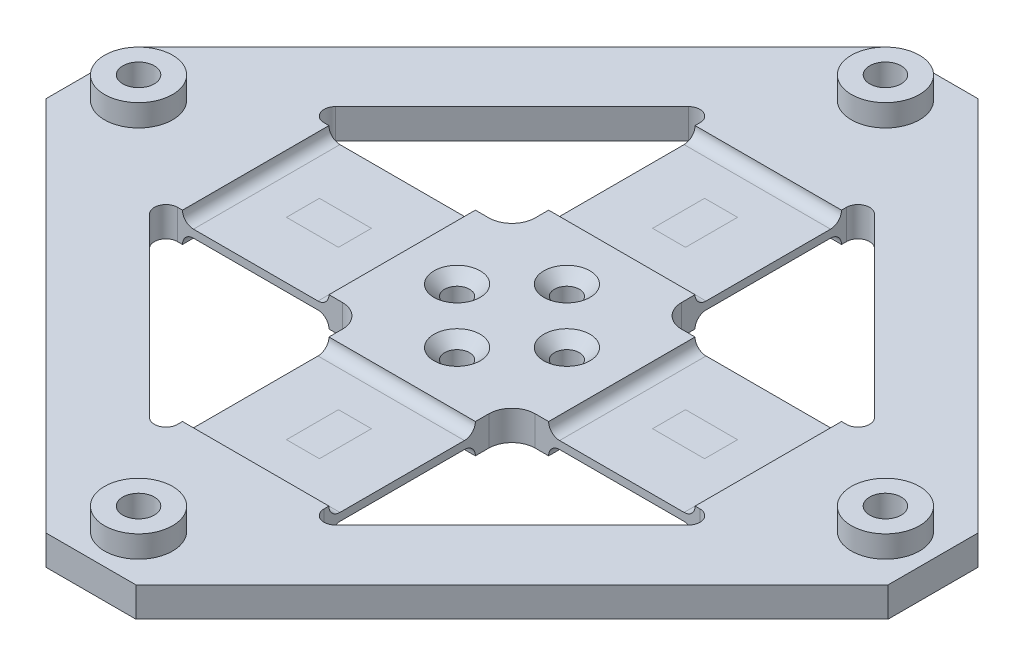
from build123d import *
from OCP.BRepFilletAPI import BRepFilletAPI_MakeFillet

# Parameters (mm, degrees)
MOUNTING_BASE_DEPTH                             = 4.064
LOAD_CELL_ARMS_DEPTH                            = 4.064
M4_CLEARANCE_HOLE1_D                            = 4.3
FILLET1_R1                                      = 3.175
FILLET1_R2                                      = 1.5875
SKETCH15_R                                      = 4.65
SKETCH15_R_2                                    = 2.15
BOSS_EXTRUDE2_DEPTH                             = 3
SKETCH12_OUTSIDE_W                              = 165.308
SKETCH12_OUTSIDE_H                              = 165.308
SKETCH12_OUTSIDE_W_2                            = 115
SKETCH12_OUTSIDE_H_2                            = 115
CUT_EXTRUDE2_DEPTH                              = 20
CSK_FOR_M3_FLAT_HEAD_MACHINE_SCREW1_D           = 3.4
CSK_FOR_M3_FLAT_HEAD_MACHINE_SCREW1_CSINK_D     = 6.3
CSK_FOR_M3_FLAT_HEAD_MACHINE_SCREW1_CSINK_ANGLE = 90
SKETCH14_W                                      = 20
SKETCH14_H                                      = 20
CUT_EXTRUDE3_DEPTH                              = 1.5
CUT_EXTRUDE4_START                              = -4.064
SKETCH14_2_W                                    = 20
SKETCH14_2_H                                    = 20
CUT_EXTRUDE4_DEPTH                              = 1.5
FILLET2_R                                       = 1.5


with BuildPart() as part:
    # Sketch1 → Mounting base (new body)
    with BuildSketch(Plane(origin=(0, 0, 0), x_dir=(1, 0, 0), z_dir=(0, 1, 0))):
        Polygon((-63.639610307, 0), (0, -63.639610307), (63.639610307, 0), (0, 63.639610307), align=None)
        Polygon((-49.497474683, 0), (0, 49.497474683), (49.497474683, 0), (0, -49.497474683), align=None, mode=Mode.SUBTRACT)
    extrude(amount=MOUNTING_BASE_DEPTH)

    # Sketch2 → load cell arms (add, through all)
    with BuildSketch(Plane(origin=(0, 4.064, 0), x_dir=(1, 0, 0), z_dir=(0, 1, 0))):
        Polygon((-49.497474683, 10), (-49.497474683, -10), (-10, -10), (-10, -49.497474683), (10, -49.497474683), (10, -10), (49.497474683, -10), (49.497474683, 10), (10, 10), (10, 49.497474683), (-10, 49.497474683), (-10, 10), align=None)
    extrude(amount=-LOAD_CELL_ARMS_DEPTH)

    # M4 Clearance Hole1 (through all)
    with Locations(Plane(origin=(0, 4.064, 0), x_dir=(1, 0, 0), z_dir=(0, 1, 0))):
        with Locations((-51, 0), (0, 51), (51, 0), (0, -51)):
            Hole(M4_CLEARANCE_HOLE1_D / 2)

    # Fillet1: one fillet with a radius per group of edges: ONE call of the kernel's fillet builder (fillet() takes one radius for all edges)
    fillet1_edges_1 = [part.edges().sort_by_distance(p)[0] for p in [
        (-10, 2.032, 10),
        (-10, 2.032, -10),
        (10, 2.032, -10),
        (10, 2.032, 10),
    ]]
    fillet1_edges_2 = [part.edges().sort_by_distance(p)[0] for p in [
        (-39.497474683, 2.032, -10),
        (-39.497474683, 2.032, 10),
        (-10, 2.032, 39.497474683),
        (10, 2.032, 39.497474683),
        (39.497474683, 2.032, 10),
        (39.497474683, 2.032, -10),
        (10, 2.032, -39.497474683),
        (-10, 2.032, -39.497474683),
    ]]
    fillet1 = BRepFilletAPI_MakeFillet(part.part.solid().wrapped)
    for e in fillet1_edges_1:
        fillet1.Add(FILLET1_R1, e.wrapped)
    for e in fillet1_edges_2:
        fillet1.Add(FILLET1_R2, e.wrapped)
    add(Compound.cast(fillet1.Shape()), mode=Mode.REPLACE)

    # Sketch15 → Boss-Extrude2 (add)
    # profile 1 of 4: a face of its own
    with BuildSketch(Plane(origin=(0, 4.064, 0), x_dir=(1, 0, 0), z_dir=(0, 1, 0))):
        with Locations(Location((0, -51, 0), (0, 0, 90))):
            Circle(SKETCH15_R)
        with Locations(Location((0, -51, 0), (0, 0, 270))):
            Circle(SKETCH15_R_2, mode=Mode.SUBTRACT)
    # profile 2 of 4: a face of its own
    with BuildSketch(Plane(origin=(0, 4.064, 0), x_dir=(1, 0, 0), z_dir=(0, 1, 0))):
        with Locations(Location((-51, 0, 0), (0, 0, 90))):
            Circle(SKETCH15_R)
        with Locations(Location((-51, 0, 0), (0, 0, 270))):
            Circle(SKETCH15_R_2, mode=Mode.SUBTRACT)
    # profile 3 of 4: a face of its own
    with BuildSketch(Plane(origin=(0, 4.064, 0), x_dir=(1, 0, 0), z_dir=(0, 1, 0))):
        with Locations(Location((0, 51, 0), (0, 0, 90))):
            Circle(SKETCH15_R)
        with Locations(Location((0, 51, 0), (0, 0, 270))):
            Circle(SKETCH15_R_2, mode=Mode.SUBTRACT)
    # profile 4 of 4: a face of its own
    with BuildSketch(Plane(origin=(0, 4.064, 0), x_dir=(1, 0, 0), z_dir=(0, 1, 0))):
        with Locations(Location((51, 0, 0), (0, 0, 90))):
            Circle(SKETCH15_R)
        with Locations(Location((51, 0, 0), (0, 0, 270))):
            Circle(SKETCH15_R_2, mode=Mode.SUBTRACT)
    extrude(amount=BOSS_EXTRUDE2_DEPTH)

    # Sketch12 outside → Cut-Extrude2 (cut)
    with BuildSketch(Plane(origin=(0, 0, 0), x_dir=(1, 0, 0), z_dir=(0, 1, 0))):
        Rectangle(SKETCH12_OUTSIDE_W, SKETCH12_OUTSIDE_H)
        Rectangle(SKETCH12_OUTSIDE_W_2, SKETCH12_OUTSIDE_H_2, mode=Mode.SUBTRACT)
    extrude(amount=CUT_EXTRUDE2_DEPTH, mode=Mode.SUBTRACT)

    # CSK for M3 Flat Head Machine Screw1 (through all)
    with Locations(Plane(origin=(0, 4.064, -7.5), x_dir=(0, 0, 1), z_dir=(0, 1, 0))):
        with Locations((0, 0), (7.5, 7.5), (15, 0), (7.5, -7.5)):
            CounterSinkHole(CSK_FOR_M3_FLAT_HEAD_MACHINE_SCREW1_D / 2, CSK_FOR_M3_FLAT_HEAD_MACHINE_SCREW1_CSINK_D / 2, counter_sink_angle=CSK_FOR_M3_FLAT_HEAD_MACHINE_SCREW1_CSINK_ANGLE)

    # Sketch14 → Cut-Extrude3 (cut)
    with BuildSketch(Plane(origin=(0, 4.064, 0), x_dir=(1, 0, 0), z_dir=(0, 1, 0))):
        with Locations((-25, 0)):
            Rectangle(SKETCH14_W, SKETCH14_H)
        with Locations((0, 25)):
            Rectangle(SKETCH14_W, SKETCH14_H)
        with Locations((25, 0)):
            Rectangle(SKETCH14_W, SKETCH14_H)
        with Locations((0, -25)):
            Rectangle(SKETCH14_W, SKETCH14_H)
    extrude(amount=-CUT_EXTRUDE3_DEPTH, mode=Mode.SUBTRACT)

    # Sketch14<2> → Cut-Extrude4 (cut)
    with BuildSketch(Plane(origin=(0, 4.064, 0), x_dir=(1, 0, 0), z_dir=(0, 1, 0)).offset(CUT_EXTRUDE4_START)):
        with Locations((-25, 0)):
            Rectangle(SKETCH14_2_W, SKETCH14_2_H)
        with Locations((0, 25)):
            Rectangle(SKETCH14_2_W, SKETCH14_2_H)
        with Locations((25, 0)):
            Rectangle(SKETCH14_2_W, SKETCH14_2_H)
        with Locations((0, -25)):
            Rectangle(SKETCH14_2_W, SKETCH14_2_H)
    extrude(amount=CUT_EXTRUDE4_DEPTH, mode=Mode.SUBTRACT)

    # Fillet2
    fillet2_edges = [part.edges().sort_by_distance(p)[0] for p in [
        (0, 2.564, 35),
        (0, 2.564, 15),
        (0, 1.5, 15),
        (0, 1.5, 35),
        (15, 1.5, 0),
        (35, 1.5, 0),
        (0, 1.5, -15),
        (-15, 1.5, 0),
        (-35, 1.5, 0),
        (0, 1.5, -35),
        (15, 2.564, 0),
        (35, 2.564, 0),
        (0, 2.564, -35),
        (0, 2.564, -15),
        (-15, 2.564, 0),
        (-35, 2.564, 0),
    ]]
    fillet(fillet2_edges, radius=FILLET2_R - 0.0001)  # a hair under: the kernel refuses the full size


solid = part.part
